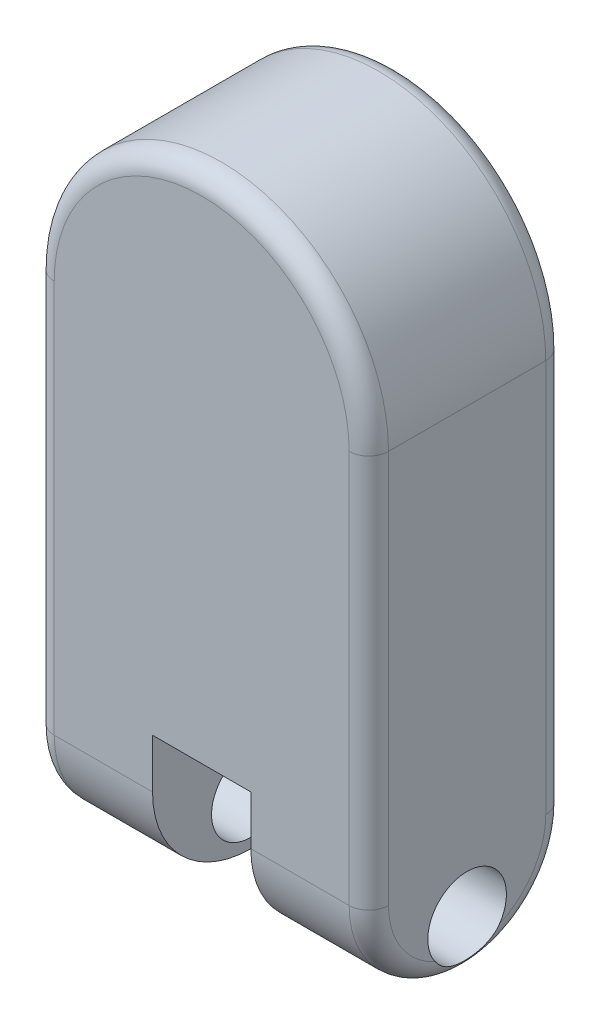
from build123d import *

# Parameters (mm, degrees)
BOSS_EXTRUDE1_DEPTH    = 100
SKETCH2_W              = 50
SKETCH2_H              = 50
CUT_EXTRUDE1_DEPTH     = 182.245689604
CUT_EXTRUDE2_DEPTH     = 25
SKETCH7_R              = 20
CUT_EXTRUDE3_DEPTH     = 234.505888577
FILLET2_R              = 50
CUT_EXTRUDE6_START     = -125
CUT_EXTRUDE6_OUTLINE_W = 50
CUT_EXTRUDE6_OUTLINE_H = 6.698729811
CUT_EXTRUDE6_DEPTH     = 50
CUT_EXTRUDE7_DEPTH     = 25
BOSS_EXTRUDE2_DEPTH    = 100
FILLET4_R              = 10
SKETCH11_W             = 50
SKETCH11_H             = 25
CUT_EXTRUDE11_DEPTH    = 99
SKETCH16_W             = 50
SKETCH16_H             = 30
BOSS_EXTRUDE3_DEPTH    = 0.1
FILLET5_R              = 10


with BuildPart() as part:
    # Sketch1 → Boss-Extrude1 (new body)
    with BuildSketch(Plane.XY):
        Polygon((-85, 125), (10.2, 125), (59.8, 125), (85, 125), (85, -125), (-85, -125), align=None)
    extrude(amount=-BOSS_EXTRUDE1_DEPTH)

    # Sketch2 → Cut-Extrude1 (cut, through all)
    with BuildSketch(Plane.XY):
        with Locations((0, -125)):
            Rectangle(SKETCH2_W, SKETCH2_H)
    extrude(amount=-CUT_EXTRUDE1_DEPTH, mode=Mode.SUBTRACT)

    # Sketch6 → Cut-Extrude2 (cut, symmetric)
    with BuildSketch(Plane(origin=(0, 0, 0), x_dir=(0, 0, -1), z_dir=(1, 0, 0))):
        with BuildLine():
            Line((100, -100), (0, -100))
            ThreePointArc((0, -100), (50, -50), (100, -100))
        make_face()
    extrude(amount=CUT_EXTRUDE2_DEPTH, both=True, mode=Mode.SUBTRACT)

    # Sketch7 → Cut-Extrude3 (cut, through all)
    with BuildSketch(Plane.ZY.offset(85)):
        with Locations(Location((-50, -100, 0), (0, 0, 270))):
            Circle(SKETCH7_R)
    extrude(amount=-CUT_EXTRUDE3_DEPTH, mode=Mode.SUBTRACT)

    # Fillet2
    fillet2_edges = [part.edges().sort_by_distance(p)[0] for p in [
        (-55, -125, -100),
        (-55, -125, 0),
    ]]
    fillet(fillet2_edges, radius=FILLET2_R - 0.0001)  # a hair under: the kernel refuses the full size

    # Cut-Extrude6: read off the stored shape, not the designer's step
    # Cut-Extrude6 outline → Cut-Extrude6 (cut)
    with BuildSketch(Plane(origin=(0, 0, 0), x_dir=(1, 0, 0), z_dir=(0, 1, 0)).offset(CUT_EXTRUDE6_START)):
        with Locations((0, 96.650635095)):
            Rectangle(CUT_EXTRUDE6_OUTLINE_W, CUT_EXTRUDE6_OUTLINE_H)
        with Locations((0, 3.349364906)):
            Rectangle(CUT_EXTRUDE6_OUTLINE_W, CUT_EXTRUDE6_OUTLINE_H)
    extrude(amount=CUT_EXTRUDE6_DEPTH, mode=Mode.SUBTRACT)

    # Sketch10 → Cut-Extrude7 (cut, symmetric)
    with BuildSketch(Plane(origin=(0, 0, 0), x_dir=(0, 0, -1), z_dir=(1, 0, 0))):
        with BuildLine():
            Line((0, -75), (100, -75))
            ThreePointArc((100, -75), (50, -61.602540378), (0, -75))
        make_face()
    extrude(amount=CUT_EXTRUDE7_DEPTH, both=True, mode=Mode.SUBTRACT)

    # Sketch15 → Boss-Extrude2 (add)
    with BuildSketch(Plane.XY):
        with BuildLine():
            Line((-85, 125), (85, 125))
            ThreePointArc((85, 125), (0, 210), (-85, 125))
        make_face()
    extrude(amount=-BOSS_EXTRUDE2_DEPTH)

    # Fillet4
    # the kernel refuses this fillet: 10 mm, written as the material it takes off along each edge
    with BuildSketch(Plane(origin=(0, 125, -100), x_dir=(1, 0, 0), z_dir=(0, -1, 0))) as fillet4_piece_1:
        with BuildLine():
            CenterArc((85 - FILLET4_R, FILLET4_R), FILLET4_R, 270, 90)
            Line((85, FILLET4_R), (85, 0))
            Line((85, 0), (85 - FILLET4_R, 0))
        make_face()
    revolve(axis=Axis((0, 125, -100), (0, 0, 1)), revolution_arc=180, mode=Mode.SUBTRACT)
    with BuildSketch(Plane(origin=(0, 125, 0), x_dir=(1, 0, 0), z_dir=(0, -1, 0))) as fillet4_piece_2:
        with BuildLine():
            CenterArc((85 - FILLET4_R, -FILLET4_R), FILLET4_R, 0, 90)
            Line((85, -FILLET4_R), (85, 0))
            Line((85, 0), (85 - FILLET4_R, 0))
        make_face()
    revolve(axis=Axis((0, 125, 0), (0, 0, 1)), revolution_arc=180, mode=Mode.SUBTRACT)
    with BuildSketch(Plane(origin=(-85, -75.0001, -100), x_dir=(0, 0, 1), z_dir=(0, 1, 0)), Plane(origin=(85, 125, 0), x_dir=(-1, 0, 0), z_dir=(0, -1, 0))) as fillet4_piece_3:
        with BuildLine():
            CenterArc((FILLET4_R, FILLET4_R), FILLET4_R, 180, 90)
            Line((0, FILLET4_R), (0, 0))
            Line((0, 0), (FILLET4_R, 0))
        make_face()
    extrude(amount=200.0001, mode=Mode.SUBTRACT)
    with BuildSketch(Plane(origin=(85, 125, -100), x_dir=(-1, 0, 0), z_dir=(0, -1, 0)), Plane(origin=(-85, -75.0001, 0), x_dir=(0, 0, -1), z_dir=(0, 1, 0))) as fillet4_piece_4:
        with BuildLine():
            CenterArc((FILLET4_R, -FILLET4_R), FILLET4_R, 90, 90)
            Line((0, -FILLET4_R), (0, 0))
            Line((0, 0), (FILLET4_R, 0))
        make_face()
    extrude(amount=200.0001, mode=Mode.SUBTRACT)
    with BuildSketch(Plane(origin=(85, -75.0001, -49.9999), x_dir=(0, 0, 1), z_dir=(0, 1, 0))) as fillet4_piece_5:
        with BuildLine():
            CenterArc((49.9999 - FILLET4_R, -FILLET4_R), FILLET4_R, 0, 90)
            Line((49.9999 - FILLET4_R, 0), (49.9999, 0))
            Line((49.9999, 0), (49.9999, -FILLET4_R))
        make_face()
    revolve(axis=Axis((85, -75.0001, -49.9999), (1, 0, 0)), revolution_arc=90, mode=Mode.SUBTRACT)
    with BuildSketch(Plane(origin=(85, -75.0001, -50.0001), x_dir=(0, 0, -1), z_dir=(0, 1, 0))) as fillet4_piece_6:
        with BuildLine():
            CenterArc((49.9999 - FILLET4_R, FILLET4_R), FILLET4_R, 270, 90)
            Line((49.9999, FILLET4_R), (49.9999, 0))
            Line((49.9999, 0), (49.9999 - FILLET4_R, 0))
        make_face()
    revolve(axis=Axis((85, -75.0001, -50.0001), (-1, 0, 0)), revolution_arc=90, mode=Mode.SUBTRACT)
    with BuildSketch(Plane(origin=(-85, -75.0001, -49.9999), x_dir=(0, 0, 1), z_dir=(0, 1, 0))) as fillet4_piece_7:
        with BuildLine():
            CenterArc((49.9999 - FILLET4_R, FILLET4_R), FILLET4_R, 270, 90)
            Line((49.9999, FILLET4_R), (49.9999, 0))
            Line((49.9999, 0), (49.9999 - FILLET4_R, 0))
        make_face()
    revolve(axis=Axis((-85, -75.0001, -49.9999), (1, 0, 0)), revolution_arc=90, mode=Mode.SUBTRACT)
    with BuildSketch(Plane(origin=(-85, -75.0001, -50.0001), x_dir=(0, 0, -1), z_dir=(0, 1, 0))) as fillet4_piece_8:
        with BuildLine():
            CenterArc((49.9999 - FILLET4_R, -FILLET4_R), FILLET4_R, 0, 90)
            Line((49.9999, -FILLET4_R), (49.9999, 0))
            Line((49.9999, 0), (49.9999 - FILLET4_R, 0))
        make_face()
    revolve(axis=Axis((-85, -75.0001, -50.0001), (-1, 0, 0)), revolution_arc=90, mode=Mode.SUBTRACT)
    with BuildSketch(Plane(origin=(-85, -125, -49.9999), x_dir=(0, 1, 0), z_dir=(0, 0, -1))) as fillet4_piece_9:
        with BuildLine():
            CenterArc((FILLET4_R, FILLET4_R), FILLET4_R, 180, 90)
            Line((0, FILLET4_R), (0, 0))
            Line((0, 0), (FILLET4_R, 0))
        make_face()
    extrude(amount=0.0002, mode=Mode.SUBTRACT)
    with BuildSketch(Plane(origin=(85, -125, -49.9999), x_dir=(0, 1, 0), z_dir=(0, 0, -1))) as fillet4_piece_10:
        with BuildLine():
            CenterArc((FILLET4_R, -FILLET4_R), FILLET4_R, 90, 90)
            Line((0, -FILLET4_R), (0, 0))
            Line((0, 0), (FILLET4_R, 0))
        make_face()
    extrude(amount=0.0002, mode=Mode.SUBTRACT)

    # Sketch11 → Cut-Extrude11 (cut)
    with BuildSketch(Plane.XY):
        with Locations((0, -62.5)):
            Rectangle(SKETCH11_W, SKETCH11_H)
    extrude(amount=-CUT_EXTRUDE11_DEPTH, mode=Mode.SUBTRACT)


with BuildPart() as body_2:
    # Sketch16 → Boss-Extrude3 (new body)
    with BuildSketch(Plane(origin=(0, 0, -100), x_dir=(-1, 0, 0), z_dir=(0, 0, -1))):
        with Locations((0, -90)):
            Rectangle(SKETCH16_W, SKETCH16_H)
    extrude(amount=BOSS_EXTRUDE3_DEPTH)

    # Fillet5
    # the kernel refuses this fillet: 10 mm, written as the material it takes off along each edge
    with BuildSketch(Plane(origin=(25, -71.473316005, -100.1), x_dir=(0, 0, 1), z_dir=(0, -1, 0)), Plane(origin=(-25, -108.526683995, -100.1), x_dir=(0, 0, 1), z_dir=(0, 1, 0))) as fillet5_piece_1:
        with BuildLine():
            CenterArc((10, 1.410673598), FILLET5_R, 180, 8.109614456)
            Line((0, 1.410673598), (0, 0))
            Line((0, 0), (0.1, 0))
        make_face()
    extrude(amount=37.05336799, mode=Mode.SUBTRACT)
    with BuildSketch(Plane(origin=(28.526683995, -105, -100.1), x_dir=(0, 0, 1), z_dir=(-1, 0, 0))) as fillet5_piece_2:
        with BuildLine():
            CenterArc((10, 1.410673598), FILLET5_R, 180, 8.109614456)
            Line((0, 1.410673598), (0, 0))
            Line((0, 0), (0.1, 0))
        make_face()
    extrude(amount=57.05336799, mode=Mode.SUBTRACT)


solid = Compound([part.part, body_2.part])
